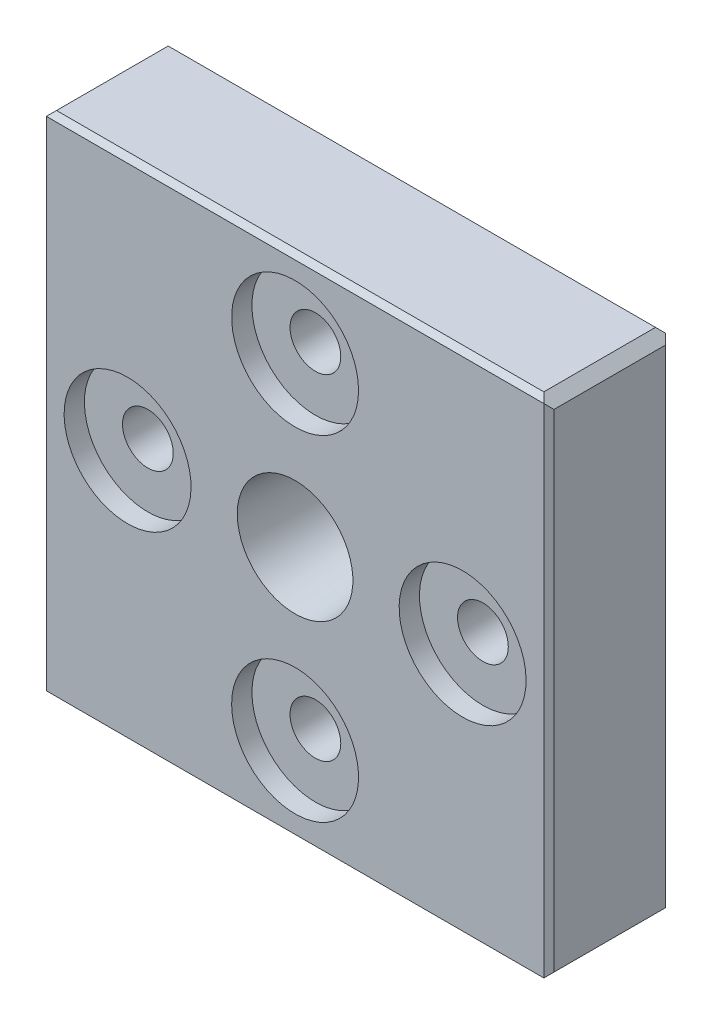
from build123d import *

# Parameters (mm, degrees)
SKETCH1_W           = 50
SKETCH1_H           = 50
BOSS_EXTRUDE1_DEPTH = 6
CUT_EXTRUDE1_REACH  = 39.336
SKETCH5_R           = 5
CHAMFER1_SIZE       = 1
CHAMFER2_SIZE       = 0.5
M6_TAPPED_HOLE1_D   = 5
SKETCH10_R          = 6.25
CUT_EXTRUDE2_DEPTH  = 2
CIRPATTERN1_COUNT   = 4


# Read off the part's stored shape, not the designer's step: Draft1
with BuildPart() as part:
    # Sketch1 → Boss-Extrude1 (new, symmetric)
    with BuildSketch(Plane.XY):
        Rectangle(SKETCH1_W, SKETCH1_H)
    extrude(amount=BOSS_EXTRUDE1_DEPTH, both=True)

    # Sketch5 → Cut-Extrude1 (cut, up to next)
    with BuildSketch(Plane.XY.offset(6), mode=Mode.PRIVATE) as cut_extrude1_sk1:
        Circle(SKETCH5_R)
    cut_extrude1_tool1 = extrude(cut_extrude1_sk1.sketch, amount=-CUT_EXTRUDE1_REACH, mode=Mode.PRIVATE) & part.part
    add(cut_extrude1_tool1.solids().sort_by_distance((0, 0, 6))[0], mode=Mode.SUBTRACT)

    # Chamfer1
    chamfer1_edges = [part.edges().sort_by_distance(p)[0] for p in [
        (25, -25, 0),
        (-25, -25, 0),
        (-25, 25, 0),
        (25, 25, 0),
    ]]
    chamfer(chamfer1_edges, length=CHAMFER1_SIZE)

    # Chamfer2
    chamfer2_edges = [part.edges().sort_by_distance(p)[0] for p in [
        (0, -25, 6),
        (0, -25, -6),
        (0, 25, -6),
        (0, 25, 6),
        (25, 0, -6),
        (25, 0, 6),
        (-25, 0, -6),
        (-25, 0, 6),
    ]]
    chamfer(chamfer2_edges, length=CHAMFER2_SIZE - 0.0001)  # a hair under: the kernel refuses the full size

    # M6 Tapped Hole1 (through all)
    with Locations(Plane.XY.offset(6)):
        with Locations((-16.5, 0), (0, 16.5), (16.5, 0), (0, -16.5)):
            Hole(M6_TAPPED_HOLE1_D / 2)

    # Sketch10 → Cut-Extrude2 (cut)
    with BuildSketch(Plane.XY.offset(6)):
        with Locations((0, 16.5)):
            Circle(SKETCH10_R)
    cut_extrude2 = extrude(amount=-CUT_EXTRUDE2_DEPTH, mode=Mode.SUBTRACT)

    # CirPattern1: Cut-Extrude2 ×4 about axis
    cirpattern1_axis = Axis((0, 0, 0), (0, 0, 1))
    for i in range(1, CIRPATTERN1_COUNT):
        add(cut_extrude2.rotate(cirpattern1_axis, i * 360 / CIRPATTERN1_COUNT), mode=Mode.SUBTRACT)

    # Draft1 outline → Draft1 (revolve, cut)
    with BuildSketch(Plane.XZ):
        Polygon((5, 6), (5, -2.8), (5.69257502, 6), align=None)
    revolve(axis=Axis((0, 0, 0), (0, 0, 1)), mode=Mode.SUBTRACT)


solid = part.part
